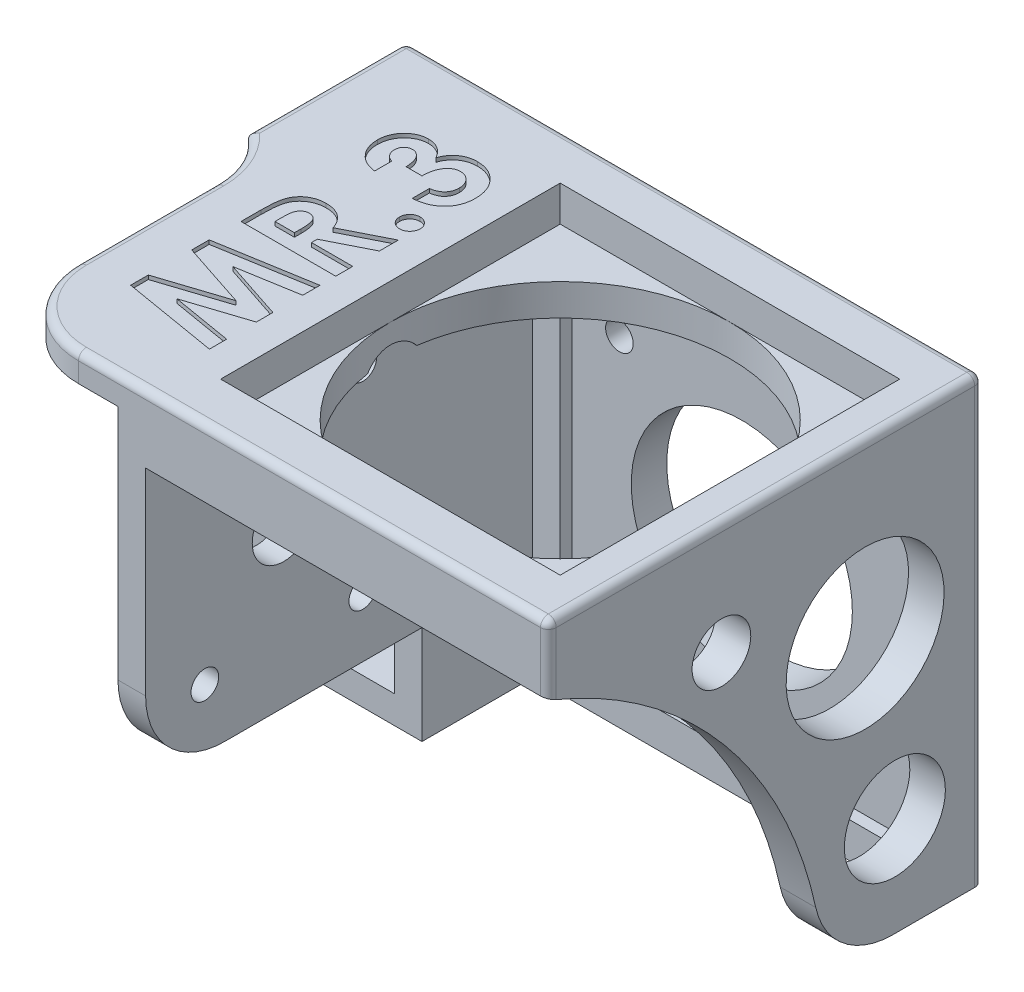
from build123d import *

# Parameters (mm, degrees)
SKETCH1_W           = 15
SKETCH1_H           = 15
BOSS_EXTRUDE2_DEPTH = 20
SKETCH2_W           = 43
SKETCH2_H           = 43
SKETCH2_W_2         = 15
SKETCH2_H_2         = 15
CUT_EXTRUDE1_DEPTH  = 15.5
SKETCH3_R           = 14
SKETCH3_R_2         = 1.75
CUT_EXTRUDE2_DEPTH  = 4.5
BOSS_EXTRUDE3_DEPTH = 35
SKETCH6_W           = 43
SKETCH6_H           = 43
CUT_EXTRUDE3_DEPTH  = 4.5
SKETCH7_R           = 21.5
CUT_EXTRUDE4_DEPTH  = 4
SKETCH8_R           = 4
SKETCH8_R_2         = 1.75
CUT_EXTRUDE5_DEPTH  = 4
SKETCH9_W           = 43
SKETCH9_H           = 4.5
CUT_EXTRUDE6_DEPTH  = 14
FILLET2_R           = 10
SKETCH10_R          = 4
CUT_EXTRUDE7_DEPTH  = 9
BOSS_EXTRUDE4_DEPTH = 4.5
FILLET3_R           = 10
SKETCH12_W          = 3.5
SKETCH12_H          = 47.5
CUT_EXTRUDE8_DEPTH  = 14
CUT_EXTRUDE9_DEPTH  = 0.5
SKETCH15_R          = 10
SKETCH15_R_2        = 3.716861159
SKETCH15_R_3        = 6.3970329
CUT_EXTRUDE10_DEPTH = 4.5
FILLET4_R           = 10
SKETCH17_W          = 15
SKETCH17_H          = 5.5
CUT_EXTRUDE12_DEPTH = 15.5
FILLET5_R           = 1
FILLET6_R           = 1


with BuildPart() as part:
    # Sketch1 → Boss-Extrude2 (new body)
    with BuildSketch(Plane.XY):
        Polygon((-36.777103754, 43.397171744), (-36.777103754, -12.602828256), (36.222896246, -12.602828256), (36.222896246, 43.397171744), (-14.777103754, 43.397171744), align=None)
        with Locations((-25.777103754, 32.397171744)):
            Rectangle(SKETCH1_W, SKETCH1_H, mode=Mode.SUBTRACT)
    extrude(amount=BOSS_EXTRUDE2_DEPTH)

    # Sketch2 → Cut-Extrude1 (cut)
    with BuildSketch(Plane.XY.offset(20)):
        with Locations((10.222896246, 13.397171744)):
            Rectangle(SKETCH2_W, SKETCH2_H)
        with Locations((-25.777103754, 7.397171744)):
            Rectangle(SKETCH2_W_2, SKETCH2_H_2)
    extrude(amount=-CUT_EXTRUDE1_DEPTH, mode=Mode.SUBTRACT)

    # Sketch3 → Cut-Extrude2 (cut)
    with BuildSketch(Plane.XY.offset(4.5)):
        with Locations((10.222896246, 13.397171744)):
            Circle(SKETCH3_R)
        with Locations((25.722896246, 28.897171744)):
            Circle(SKETCH3_R_2)
        with Locations((-5.277103754, 28.897171744)):
            Circle(SKETCH3_R_2)
        with Locations((-5.277103754, -2.102828256)):
            Circle(SKETCH3_R_2)
        with Locations((25.722896246, -2.102828256)):
            Circle(SKETCH3_R_2)
    extrude(amount=-CUT_EXTRUDE2_DEPTH, mode=Mode.SUBTRACT)

    # Sketch5 → Boss-Extrude3 (add)
    with BuildSketch(Plane.XY.offset(20)):
        Polygon((-33.277103754, 39.897171744), (-33.277103754, 43.397171744), (-18.277103754, 43.397171744), (-14.777103754, 43.397171744), (36.222896246, 43.397171744), (36.222896246, 34.897171744), (-14.777103754, 34.897171744), (-14.777103754, -0.102828256), (-18.277103754, -0.102828256), (-18.277103754, 39.897171744), align=None)
    extrude(amount=BOSS_EXTRUDE3_DEPTH)

    # Sketch6 → Cut-Extrude3 (cut)
    with BuildSketch(Plane(origin=(0, 43.397171744, 0), x_dir=(1, 0, 0), z_dir=(0, 1, 0))):
        with Locations((10.222896246, -27.5)):
            Rectangle(SKETCH6_W, SKETCH6_H)
    extrude(amount=-CUT_EXTRUDE3_DEPTH, mode=Mode.SUBTRACT)

    # Sketch7 → Cut-Extrude4 (cut)
    with BuildSketch(Plane(origin=(0, 38.897171744, 0), x_dir=(1, 0, 0), z_dir=(0, 1, 0))):
        with Locations(Location((10.222896246, -27.5, 0), (0, 0, 180))):
            Circle(SKETCH7_R)
    extrude(amount=-CUT_EXTRUDE4_DEPTH, mode=Mode.SUBTRACT)

    # Sketch8 → Cut-Extrude5 (cut)
    with BuildSketch(Plane.ZY.offset(18.277103754)):
        with Locations((37.5, 19.897171744)):
            Circle(SKETCH8_R)
        with Locations((27.5, 32.397171744)):
            Circle(SKETCH8_R_2)
        with Locations((27.5, 7.397171744)):
            Circle(SKETCH8_R_2)
        with Locations((47.5, 7.397171744)):
            Circle(SKETCH8_R_2)
        with Locations((47.5, 32.397171744)):
            Circle(SKETCH8_R_2)
    extrude(amount=-CUT_EXTRUDE5_DEPTH, mode=Mode.SUBTRACT)

    # Sketch9 → Cut-Extrude6 (cut)
    with BuildSketch(Plane.XY.offset(20)):
        with Locations((10.222896246, -10.352828256)):
            Rectangle(SKETCH9_W, SKETCH9_H)
    extrude(amount=-CUT_EXTRUDE6_DEPTH, mode=Mode.SUBTRACT)

    # Fillet2
    fillet2_edges = [part.edges().sort_by_distance(p)[0] for p in [
        (-16.527103754, -0.102828256, 55),
    ]]
    fillet(fillet2_edges, radius=FILLET2_R)

    # Sketch10 → Cut-Extrude7 (cut)
    with BuildSketch(Plane(origin=(-14.777103754, 0, 0), x_dir=(0, 0, -1), z_dir=(1, 0, 0))):
        with Locations((-27.5, 32.397171744)):
            Circle(SKETCH10_R)
        with Locations((-47.5, 32.397171744)):
            Circle(SKETCH10_R)
    extrude(amount=CUT_EXTRUDE7_DEPTH, mode=Mode.SUBTRACT)

    # Sketch11 → Boss-Extrude4 (add)
    with BuildSketch(Plane(origin=(36.222896246, 0, 0), x_dir=(0, 0, -1), z_dir=(1, 0, 0))):
        with BuildLine():
            Line((-20, -12.602828256), (-20, 34.897171744))
            Line((-20, 34.897171744), (-55, 34.897171744))
            ThreePointArc((-55, 34.897171744), (-30.621326268, 16.215668178), (-20, -12.602828256))
        make_face()
    extrude(amount=-BOSS_EXTRUDE4_DEPTH)

    # Fillet3
    # the kernel refuses this fillet: 10 mm, written as the material it adds along each edge
    with BuildSketch(Plane(origin=(-33.277103754, 39.897171744, 20), x_dir=(0, 0, 1), z_dir=(0, 1, 0))) as fillet3_piece_1:
        with BuildLine():
            CenterArc((7.599342077, -10), FILLET3_R, 90, 49.458398126)
            Line((0, -3.5), (0, 0))
            Line((0, 0), (7.599342077, 0))
        make_face()
    extrude(amount=3.5)
    # the kernel refuses this fillet: 10 mm, written as the material it takes off along each edge
    with BuildSketch(Plane(origin=(-33.277103754, 14.897171744, 55), x_dir=(1, 0, 0), z_dir=(0, 1, 0))) as fillet3_2_piece_1:
        with BuildLine():
            CenterArc((FILLET3_R, FILLET3_R), FILLET3_R, 180, 90)
            Line((0, FILLET3_R), (0, 0))
            Line((0, 0), (FILLET3_R, 0))
        make_face()
    extrude(amount=53.5, mode=Mode.SUBTRACT)

    # Sketch12 → Cut-Extrude8 (cut)
    with BuildSketch(Plane.XY.offset(20)):
        with Locations((-13.027103754, 11.147171744)):
            Rectangle(SKETCH12_W, SKETCH12_H)
    extrude(amount=-CUT_EXTRUDE8_DEPTH, mode=Mode.SUBTRACT)

    # Sketch13 → Cut-Extrude9 (cut)
    # profile 1 of 4: a face of its own
    with BuildSketch(Plane(origin=(0, 43.397171744, 0), x_dir=(1, 0, 0), z_dir=(0, 1, 0))):
        with BuildLine():
            Line((-24.354026831, -14.269230769), (-24.354026831, -16.423076923))
            add(Edge.make_bspline(
                [(-24.354026831, -16.423076923), (-24.461713477, -16.407964815), (-24.672052148, -16.378447127), (-24.977298601, -16.305884538), (-25.267565461, -16.221970302), (-25.541294956, -16.114655863), (-25.798192002, -15.990780702), (-26.038486488, -15.846325454), (-26.265626841, -15.687992933), (-26.401745026, -15.564028468), (-26.469411447, -15.502403846)],
                knots=[0, 0, 0, 0, 1.1115466, 2.171125598, 3.205689823, 4.19946166, 5.17440286, 6.118867946, 7.064860634, 8, 8, 8, 8], degree=3))
            add(Edge.make_bspline(
                [(-26.469411447, -15.502403846), (-26.558830413, -15.413737708), (-26.7350658, -15.238986069), (-26.960803863, -14.946955584), (-27.156164805, -14.640853704), (-27.311048372, -14.314541423), (-27.436408677, -13.973096405), (-27.520613478, -13.61380336), (-27.576484106, -13.238130491), (-27.581987557, -12.981781018), (-27.584796062, -12.850961538)],
                knots=[0, 0, 0, 0, 1.01925491, 2.00884431, 2.983262333, 3.955970413, 4.92937149, 5.924503185, 6.940838805, 8, 8, 8, 8], degree=3))
            add(Edge.make_bspline(
                [(-27.584796062, -12.850961538), (-27.582050323, -12.73465629), (-27.576652753, -12.506023607), (-27.533323993, -12.169991091), (-27.457330173, -11.849612209), (-27.357969959, -11.541500462), (-27.222773782, -11.25018717), (-27.065839795, -10.969242767), (-26.87335374, -10.706516847), (-26.655863868, -10.461394684), (-26.42062728, -10.236203226), (-26.169178714, -10.041186437), (-25.90823494, -9.873527004), (-25.635628008, -9.735397808), (-25.350896635, -9.629195227), (-25.055685675, -9.555487485), (-24.750646535, -9.507243979), (-24.54331554, -9.502437665), (-24.438161447, -9.5)],
                knots=[0, 0, 0, 0, 1.091422571, 2.145516843, 3.172569842, 4.178562979, 5.178154469, 6.181868002, 7.194278174, 8.227918432, 9.254613415, 10.245994977, 11.209837596, 12.161663635, 13.10878368, 14.055455738, 15.013766427, 16, 16, 16, 16], degree=3))
            add(Edge.make_bspline(
                [(-24.438161447, -9.5), (-24.307959977, -9.50509855), (-24.050848113, -9.515166774), (-23.675286182, -9.594791656), (-23.31699755, -9.722793195), (-22.98022743, -9.904792416), (-22.665326634, -10.133343672), (-22.383293235, -10.413618479), (-22.129759449, -10.737795474), (-21.993508651, -10.981152698), (-21.92373837, -11.105769231)],
                knots=[0, 0, 0, 0, 0.992776698, 1.96045919, 2.915875678, 3.886951799, 4.871409521, 5.874469288, 6.911574252, 8, 8, 8, 8], degree=3))
            add(Edge.make_bspline(
                [(-21.92373837, -11.105769231), (-21.895659048, -11.020231156), (-21.840484441, -10.852152676), (-21.731751558, -10.613297498), (-21.613177033, -10.385986571), (-21.474753956, -10.175418417), (-21.326076769, -9.975818705), (-21.159151539, -9.793502499), (-20.978262971, -9.623748781), (-20.781486751, -9.470757048), (-20.572094557, -9.333975346), (-20.353849904, -9.213430969), (-20.125955143, -9.11227158), (-19.890084989, -9.027369011), (-19.643918089, -8.962590703), (-19.388288671, -8.917016814), (-19.123812667, -8.890665409), (-18.944629097, -8.886647166), (-18.854026831, -8.884615385)],
                knots=[0, 0, 0, 0, 1.059375415, 2.081625174, 3.086260357, 4.075579879, 5.045586876, 6.014170127, 6.982201689, 7.963705737, 8.945119069, 9.924852636, 10.896327119, 11.878239286, 12.873838556, 13.889973282, 14.933087432, 16, 16, 16, 16], degree=3))
            add(Edge.make_bspline(
                [(-18.854026831, -8.884615385), (-18.720878398, -8.888734418), (-18.458336805, -8.896856312), (-18.07164063, -8.948492781), (-17.702957398, -9.04462684), (-17.348058012, -9.1711089), (-17.011475354, -9.339775918), (-16.685670652, -9.538438844), (-16.381692781, -9.78160844), (-16.093708135, -10.054300335), (-15.830608164, -10.355559465), (-15.598156421, -10.679733834), (-15.406536826, -11.027451515), (-15.242752347, -11.390306025), (-15.121198507, -11.776471693), (-15.032182979, -12.180953176), (-14.978023224, -12.606704154), (-14.97232273, -12.897275975), (-14.969411447, -13.045673077)],
                knots=[0, 0, 0, 0, 1.005228408, 1.982105694, 2.937129188, 3.876607107, 4.82066901, 5.774063015, 6.75178259, 7.752926466, 8.764612432, 9.766578198, 10.757677051, 11.756882247, 12.76686714, 13.807379907, 14.880213281, 16, 16, 16, 16], degree=3))
            add(Edge.make_bspline(
                [(-14.969411447, -13.045673077), (-14.972473879, -13.18605733), (-14.978462061, -13.46056016), (-15.030292808, -13.862078), (-15.113900009, -14.2436827), (-15.231751291, -14.606348122), (-15.384584265, -14.948671143), (-15.566574044, -15.273756081), (-15.788217376, -15.575115937), (-16.039508863, -15.856108455), (-16.321443642, -16.110500371), (-16.627490835, -16.337866837), (-16.958814215, -16.533194381), (-17.313998229, -16.697284044), (-17.693665977, -16.828853016), (-18.097045385, -16.932634236), (-18.524924532, -17.005127116), (-18.819314488, -17.027204974), (-18.969411447, -17.038461538)],
                knots=[0, 0, 0, 0, 1.066544725, 2.085487077, 3.070979577, 4.031932826, 4.977951092, 5.916076795, 6.857635327, 7.814973522, 8.776389752, 9.738577119, 10.707772778, 11.69409279, 12.707140348, 13.757286496, 14.856535458, 16, 16, 16, 16], degree=3))
            Line((-18.969411447, -17.038461538), (-18.969411447, -14.884615385))
            add(Edge.make_bspline(
                [(-18.969411447, -14.884615385), (-18.893941983, -14.870964024), (-18.746945412, -14.84437442), (-18.534106126, -14.792559921), (-18.337719632, -14.724860817), (-18.156343123, -14.647460652), (-17.988115193, -14.561885683), (-17.837534552, -14.459638432), (-17.698683375, -14.350006694), (-17.5390833, -14.185205211), (-17.371708872, -13.955269387), (-17.223474416, -13.643949802), (-17.139167898, -13.296056412), (-17.128678971, -13.053337686), (-17.1232576, -12.927884615)],
                knots=[0, 0, 0, 0, 0.928450228, 1.808400301, 2.64896863, 3.43999153, 4.194978884, 4.9294959, 5.640047715, 6.332896648, 7.70085756, 9.063442004, 10.482192841, 12, 12, 12, 12], degree=3))
            add(Edge.make_bspline(
                [(-17.1232576, -12.927884615), (-17.124405684, -12.861305568), (-17.126654524, -12.730892108), (-17.151353621, -12.539285256), (-17.192505502, -12.356939739), (-17.246913702, -12.182341245), (-17.320745329, -12.018233642), (-17.406426688, -11.860901248), (-17.511313643, -11.713221335), (-17.630822374, -11.576054197), (-17.758435695, -11.448397373), (-17.898078119, -11.339393229), (-18.043044495, -11.245284505), (-18.19716923, -11.171026391), (-18.355586873, -11.108876944), (-18.523332628, -11.070115297), (-18.696765325, -11.041024039), (-18.815434425, -11.039324228), (-18.875661447, -11.038461538)],
                knots=[0, 0, 0, 0, 1.110702965, 2.175618623, 3.217100552, 4.227908035, 5.221854906, 6.215531843, 7.213608581, 8.237687243, 9.249555755, 10.220750668, 11.188994735, 12.127982202, 13.071814005, 14.022160605, 14.996205625, 16, 16, 16, 16], degree=3))
            add(Edge.make_bspline(
                [(-18.875661447, -11.038461538), (-18.941551383, -11.040655333), (-19.071935008, -11.044996434), (-19.263005969, -11.083197917), (-19.44751257, -11.1403799), (-19.623932492, -11.222618207), (-19.79122819, -11.330230692), (-19.950785214, -11.461076438), (-20.101333227, -11.616339108), (-20.247256798, -11.790819373), (-20.374997599, -11.991557207), (-20.492627776, -12.2104465), (-20.586290389, -12.452879772), (-20.669928018, -12.713041013), (-20.731020743, -12.99582187), (-20.775378535, -13.299474905), (-20.808396475, -13.623507792), (-20.813133408, -13.846867977), (-20.815565293, -13.961538462)],
                knots=[0, 0, 0, 0, 0.809868251, 1.602574917, 2.388262527, 3.182133002, 3.988875265, 4.829537611, 5.714850619, 6.646378958, 7.622533229, 8.636771727, 9.698525113, 10.814716514, 11.996253919, 13.252421425, 14.589425562, 16, 16, 16, 16], degree=3))
            Line((-20.815565293, -13.961538462), (-22.815565293, -13.961538462))
            add(Edge.make_bspline(
                [(-22.815565293, -13.961538462), (-22.827678745, -13.818749484), (-22.850340615, -13.551619584), (-22.904082171, -13.181083963), (-22.973603439, -12.868078609), (-23.064208494, -12.609025797), (-23.170041723, -12.390363051), (-23.292667277, -12.202022453), (-23.433479775, -12.037700926), (-23.592274044, -11.902539612), (-23.758722816, -11.78990255), (-23.935749773, -11.712796535), (-24.116311523, -11.661114623), (-24.239902673, -11.6562544), (-24.301142216, -11.653846154)],
                knots=[0, 0, 0, 0, 1.700711886, 3.181695139, 4.441392523, 5.500267777, 6.431839453, 7.31822765, 8.161090383, 8.990537424, 9.787217293, 10.536619396, 11.274893404, 12, 12, 12, 12], degree=3))
            add(Edge.make_bspline(
                [(-24.301142216, -11.653846154), (-24.379285164, -11.657983842), (-24.531803654, -11.666059732), (-24.750479033, -11.730011612), (-24.946442954, -11.838540599), (-25.117503484, -11.985797133), (-25.257039798, -12.166703387), (-25.360818897, -12.376069429), (-25.4213598, -12.612834364), (-25.427680807, -12.779294626), (-25.430949908, -12.865384615)],
                knots=[0, 0, 0, 0, 1.009324788, 1.969988301, 2.915956825, 3.885795408, 4.868116622, 5.850437836, 6.888288533, 8, 8, 8, 8], degree=3))
            add(Edge.make_bspline(
                [(-25.430949908, -12.865384615), (-25.427108615, -12.943424744), (-25.419486312, -13.098280262), (-25.362595464, -13.32472538), (-25.266826801, -13.539772798), (-25.13476746, -13.738969491), (-24.976169789, -13.919440016), (-24.788343767, -14.067554248), (-24.582542377, -14.190748643), (-24.430497294, -14.242967504), (-24.354026831, -14.269230769)],
                knots=[0, 0, 0, 0, 0.98818071, 1.960853194, 2.938124878, 3.957524365, 4.978590984, 5.968022688, 6.978025184, 8, 8, 8, 8], degree=3))
        make_face()
    # profile 2 of 4: a face of its own
    with BuildSketch(Plane(origin=(0, 43.397171744, 0), x_dir=(1, 0, 0), z_dir=(0, 1, 0))):
        with BuildLine():
            add(Edge.make_bspline(
                [(-17.738642216, -19.884615385), (-17.734190337, -19.797559899), (-17.725413849, -19.625937653), (-17.650808332, -19.380301944), (-17.529310139, -19.155152147), (-17.364195084, -18.956447792), (-17.167037325, -18.787516037), (-16.941743747, -18.665572967), (-16.69537851, -18.589599434), (-16.523650855, -18.581214589), (-16.4357576, -18.576923077)],
                knots=[0, 0, 0, 0, 1.01719242, 2.005305523, 2.97459142, 3.994072628, 5.012345306, 5.994342214, 6.97346883, 8, 8, 8, 8], degree=3))
            add(Edge.make_bspline(
                [(-16.4357576, -18.576923077), (-16.347898226, -18.581320654), (-16.175467626, -18.589951227), (-15.927920379, -18.664925224), (-15.701827426, -18.788219983), (-15.502516108, -18.956226028), (-15.335346806, -19.155115205), (-15.210644939, -19.3796467), (-15.136631386, -19.626011851), (-15.127758419, -19.797584869), (-15.1232576, -19.884615385)],
                knots=[0, 0, 0, 0, 1.023125046, 2.0079595, 2.986698053, 4.008755096, 5.030812139, 6.001348264, 6.986182718, 8, 8, 8, 8], degree=3))
            add(Edge.make_bspline(
                [(-15.1232576, -19.884615385), (-15.127721812, -19.971666528), (-15.136522614, -20.143280212), (-15.21126894, -20.390028245), (-15.334514056, -20.616217709), (-15.502720686, -20.815155759), (-15.701113272, -20.98391745), (-15.928648854, -21.103755519), (-16.175372745, -21.179453131), (-16.347866199, -21.187968709), (-16.4357576, -21.192307692)],
                knots=[0, 0, 0, 0, 1.013339287, 1.99770941, 2.975986507, 3.997561671, 5.019136834, 5.992987214, 6.977357337, 8, 8, 8, 8], degree=3))
            add(Edge.make_bspline(
                [(-16.4357576, -21.192307692), (-16.523682905, -21.188074834), (-16.69547318, -21.179804589), (-16.941019196, -21.10311539), (-17.167747324, -20.984614499), (-17.363992984, -20.814937445), (-17.530136169, -20.616168331), (-17.6501854, -20.38938132), (-17.725521797, -20.143352915), (-17.734226666, -19.971690996), (-17.738642216, -19.884615385)],
                knots=[0, 0, 0, 0, 1.026040734, 2.004699561, 2.981785884, 3.999572071, 5.018566211, 5.995652533, 6.983293555, 8, 8, 8, 8], degree=3))
        make_face()
    # profile 3 of 4: a face of its own
    with BuildSketch(Plane(origin=(0, 43.397171744, 0), x_dir=(1, 0, 0), z_dir=(0, 1, 0))):
        with BuildLine():
            Line((-27.277103754, -30.423076923), (-27.277103754, -27.913461538))
            add(Edge.make_bspline(
                [(-27.277103754, -27.913461538), (-27.276523637, -27.747575497), (-27.275407909, -27.428529913), (-27.257426431, -26.968503267), (-27.232949353, -26.545836015), (-27.193759654, -26.160317709), (-27.147557825, -25.811011952), (-27.08733302, -25.499038234), (-27.019963611, -25.223413962), (-26.935677949, -24.982150954), (-26.840755622, -24.764351103), (-26.731366357, -24.561563699), (-26.609869306, -24.367801061), (-26.468398617, -24.189307449), (-26.319577078, -24.015647381), (-26.153367984, -23.855369987), (-25.972658509, -23.705721488), (-25.777484756, -23.569403489), (-25.571971597, -23.444046707), (-25.355375708, -23.336214698), (-25.129458932, -23.244276993), (-24.895335011, -23.167026445), (-24.650668624, -23.109428231), (-24.398249887, -23.069988224), (-24.136745166, -23.040969633), (-23.959079224, -23.039308765), (-23.868449908, -23.038461538)],
                knots=[0, 0, 0, 0, 1.748890285, 3.363608654, 4.853419723, 6.211897754, 7.448506646, 8.566916444, 9.560702549, 10.437053547, 11.257979428, 12.063058964, 12.86458444, 13.665575447, 14.461919362, 15.274455744, 16.096554533, 16.933325211, 17.78237398, 18.632472903, 19.481227396, 20.352186419, 21.229229428, 22.127857616, 23.044999956, 24, 24, 24, 24], degree=3))
            add(Edge.make_bspline(
                [(-23.868449908, -23.038461538), (-23.773856844, -23.040677276), (-23.588377086, -23.045021932), (-23.315886645, -23.068230596), (-23.054554756, -23.11137823), (-22.806058494, -23.174601942), (-22.567852823, -23.25027701), (-22.343655524, -23.348283519), (-22.129500573, -23.459732005), (-21.928917046, -23.591946056), (-21.73759434, -23.737135899), (-21.562481225, -23.905756693), (-21.395276629, -24.088280691), (-21.241674458, -24.290262214), (-21.10263091, -24.511096549), (-20.972498239, -24.746631128), (-20.853587819, -25.000121035), (-20.787077057, -25.178177578), (-20.753065293, -25.269230769)],
                knots=[0, 0, 0, 0, 1.099808295, 2.156523617, 3.176426857, 4.17500812, 5.135317955, 6.078349783, 7.015890908, 7.9382699, 8.868004242, 9.803692517, 10.759882289, 11.743580734, 12.748787378, 13.791075452, 14.870417076, 16, 16, 16, 16], degree=3))
            Line((-20.753065293, -25.269230769), (-15.277103754, -22.5))
            Line((-15.277103754, -22.5), (-15.277103754, -24.894230769))
            Line((-15.277103754, -24.894230769), (-20.507872985, -27.538461538))
            Line((-20.507872985, -27.538461538), (-20.507872985, -28.269230769))
            Line((-20.507872985, -28.269230769), (-15.277103754, -28.269230769))
            Line((-15.277103754, -28.269230769), (-15.277103754, -30.423076923))
            Line((-15.277103754, -30.423076923), (-27.277103754, -30.423076923))
        make_face()
        with BuildLine():
            Line((-22.661719139, -28.269230769), (-22.661719139, -27.430288462))
            add(Edge.make_bspline(
                [(-22.661719139, -27.430288462), (-22.662874325, -27.327720791), (-22.665086258, -27.13132574), (-22.67534612, -26.848883863), (-22.700067319, -26.592359279), (-22.731301629, -26.360650386), (-22.767366152, -26.152591246), (-22.819048801, -25.970037673), (-22.874428069, -25.810176795), (-22.943250133, -25.674902968), (-23.021515747, -25.55932812), (-23.11042743, -25.459536635), (-23.213331381, -25.376994769), (-23.327431116, -25.309058603), (-23.453735818, -25.256211652), (-23.590858948, -25.217637426), (-23.740362515, -25.196080139), (-23.843540332, -25.193599899), (-23.897296062, -25.192307692)],
                knots=[0, 0, 0, 0, 1.688639943, 3.233382647, 4.650958383, 5.928841754, 7.082724185, 8.122798841, 9.049171256, 9.863274652, 10.613301712, 11.341792392, 12.054588806, 12.776240173, 13.521029143, 14.301969904, 15.115324896, 16, 16, 16, 16], degree=3))
            add(Edge.make_bspline(
                [(-23.897296062, -25.192307692), (-23.960928563, -25.194631268), (-24.08514522, -25.199167107), (-24.264477677, -25.248209561), (-24.431659826, -25.322214323), (-24.584422597, -25.426961014), (-24.717943295, -25.557717528), (-24.83589568, -25.707813958), (-24.928125714, -25.881157729), (-24.992891781, -26.040083229), (-25.029246829, -26.186040304), (-25.056546519, -26.317311715), (-25.076832202, -26.469191242), (-25.093253113, -26.642448501), (-25.107910929, -26.835553099), (-25.117238496, -27.050396857), (-25.121346902, -27.286041663), (-25.122602363, -27.450319447), (-25.1232576, -27.536057692)],
                knots=[0, 0, 0, 0, 1.020140795, 1.991411262, 2.965409065, 3.947543434, 4.949233831, 5.95883764, 7.001880521, 8.094604842, 8.706727239, 9.41631554, 10.248493651, 11.167128553, 12.212949395, 13.360078347, 14.622198054, 16, 16, 16, 16], degree=3))
            Line((-25.1232576, -27.536057692), (-25.1232576, -28.269230769))
            Line((-25.1232576, -28.269230769), (-22.661719139, -28.269230769))
        make_face(mode=Mode.SUBTRACT)
    # profile 4 of 4: a face of its own
    with BuildSketch(Plane(origin=(0, 43.397171744, 0), x_dir=(1, 0, 0), z_dir=(0, 1, 0))):
        Polygon((-27.277103754, -44.396634615), (-27.277103754, -42.161057692), (-18.906911447, -39.423076923), (-27.277103754, -36.665865385), (-27.277103754, -34.451923077), (-15.277103754, -32.423076923), (-15.277103754, -34.603365385), (-22.856430677, -35.884615385), (-15.277103754, -38.379807692), (-15.277103754, -40.480769231), (-22.856430677, -42.961538462), (-15.277103754, -44.240384615), (-15.277103754, -46.423076923), align=None)
    extrude(amount=-CUT_EXTRUDE9_DEPTH, mode=Mode.SUBTRACT)

    # Sketch15 → Cut-Extrude10 (cut)
    with BuildSketch(Plane(origin=(36.222896246, 0, 0), x_dir=(0, 0, -1), z_dir=(1, 0, 0))):
        with Locations(Location((-14.886146104, 21.683249202, 0), (0, 0, 90))):
            Circle(SKETCH15_R)
        with Locations(Location((-33.079594898, 29.183142251, 0), (0, 0, 90))):
            Circle(SKETCH15_R_2)
        with Locations(Location((-11.117704211, 0, 0), (0, 0, 90))):
            Circle(SKETCH15_R_3)
    extrude(amount=-CUT_EXTRUDE10_DEPTH, mode=Mode.SUBTRACT)

    # Fillet4
    fillet4_edges = [part.edges().sort_by_distance(p)[0] for p in [
        (33.972896246, -12.602828256, 20),
    ]]
    fillet(fillet4_edges, radius=FILLET4_R)

    # Sketch17 → Cut-Extrude12 (cut)
    with BuildSketch(Plane.XY.offset(20)):
        with Locations((-25.777103754, -6.352828256)):
            Rectangle(SKETCH17_W, SKETCH17_H)
    extrude(amount=-CUT_EXTRUDE12_DEPTH, mode=Mode.SUBTRACT)

    # Fillet5
    fillet5_edges = [part.edges().sort_by_distance(p)[0] for p in [
        (36.222896246, 15.397171744, 0),
        (-0.277103754, 43.397171744, 0),
        (36.222896246, 43.397171744, 27.5),
        (-36.777103754, 43.397171744, 10),
        (-33.277103754, 43.397171744, 36.299671038),
        (-30.348171566, 43.397171744, 52.071067812),
        (-34.194152692, 43.397171744, 23.416041944),
        (6.472896246, 43.397171744, 55),
    ]]
    fillet(fillet5_edges, radius=FILLET5_R)

    # Fillet6
    # the kernel refuses this fillet: 1 mm, written as the material it takes off along each edge
    with BuildSketch(Plane(origin=(35.222896246, 42.397171744, 54), x_dir=(0, 0, 1), z_dir=(1, 0, 0))) as fillet6_piece_1_section:
        Polygon((0, 0), (FILLET6_R * 1.02, 0), (FILLET6_R * 1.02, -FILLET6_R * 1.02), (0, -FILLET6_R * 1.02), align=None)
    fillet6_piece_1 = extrude(amount=FILLET6_R * 1.02, mode=Mode.PRIVATE)
    fillet6_piece_1 = fillet6_piece_1 - Plane(origin=(35.222896246, 42.397171744, 54), x_dir=(0, -0.7071067811865475, -0.7071067811865475), z_dir=(1, 0, 0)) * Sphere(FILLET6_R, mode=Mode.PRIVATE)
    add(fillet6_piece_1, mode=Mode.SUBTRACT)
    with BuildSketch(Plane(origin=(-35.777103754, 42.397171744, 1), x_dir=(-1, 0, 0), z_dir=(0, 0, -1))) as fillet6_piece_2_section:
        Polygon((0, 0), (FILLET6_R * 1.02, 0), (FILLET6_R * 1.02, FILLET6_R * 1.02), (0, FILLET6_R * 1.02), align=None)
    fillet6_piece_2 = extrude(amount=FILLET6_R * 1.02, mode=Mode.PRIVATE)
    fillet6_piece_2 = fillet6_piece_2 - Plane(origin=(-35.777103754, 42.397171744, 1), x_dir=(0.7071067811865476, -0.7071067811865475, 0), z_dir=(0, 0, -1)) * Sphere(FILLET6_R, mode=Mode.PRIVATE)
    add(fillet6_piece_2, mode=Mode.SUBTRACT)
    with BuildSketch(Plane(origin=(-36.777103754, 42.397171744, 0), x_dir=(1, 0, 0), z_dir=(0, -1, 0))) as fillet6_piece_3:
        with BuildLine():
            CenterArc((FILLET6_R, FILLET6_R), FILLET6_R, 180, 90)
            Line((0, FILLET6_R), (0, 0))
            Line((0, 0), (FILLET6_R, 0))
        make_face()
    extrude(amount=57.5, mode=Mode.SUBTRACT)
    with BuildSketch(Plane(origin=(36.222896246, 42.397171744, 55), x_dir=(0, 0, -1), z_dir=(0, -1, 0))) as fillet6_piece_4:
        with BuildLine():
            CenterArc((FILLET6_R, -FILLET6_R), FILLET6_R, 90, 90)
            Line((0, -FILLET6_R), (0, 0))
            Line((0, 0), (FILLET6_R, 0))
        make_face()
    extrude(amount=10, mode=Mode.SUBTRACT)


solid = part.part
